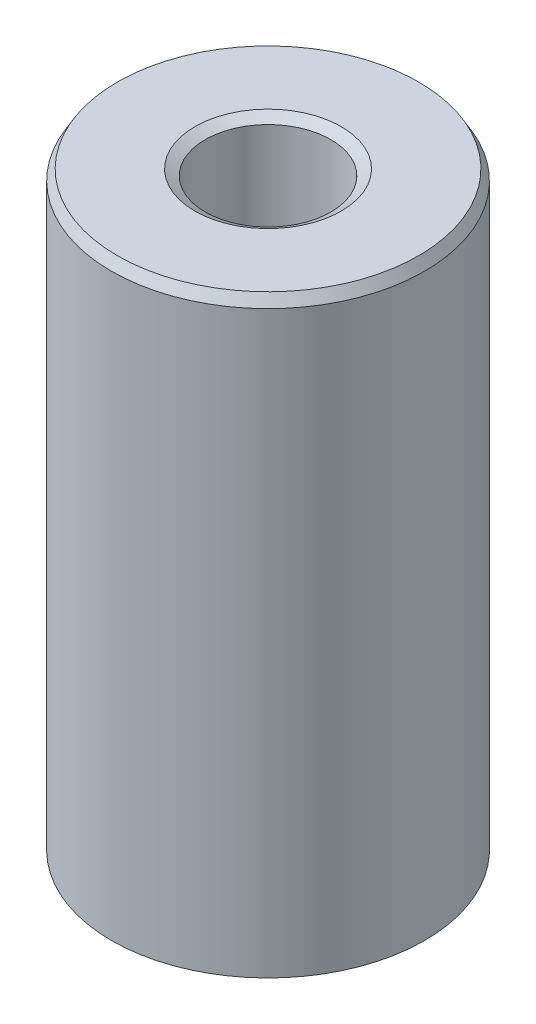
from build123d import *
from OCP.BRepFilletAPI import BRepFilletAPI_MakeChamfer

# Parameters (mm, degrees)
SKETCH1_R           = 7.5
BOSS_EXTRUDE1_DEPTH = 28.553667174
SKETCH2_R           = 3.008081758
CUT_EXTRUDE1_DEPTH  = 31.460005074
CHAMFER1_SIZE       = 0.498138445
CHAMFER1_SIZE2      = 0.287600365


with BuildPart() as part:
    # Sketch1 → Boss-Extrude1 (new body)
    with BuildSketch(Plane(origin=(0, 0, 0), x_dir=(1, 0, 0), z_dir=(0, 1, 0))):
        Circle(SKETCH1_R)
    extrude(amount=BOSS_EXTRUDE1_DEPTH)

    # Sketch2 → Cut-Extrude1 (cut, through all)
    with BuildSketch(Plane(origin=(0, 0, 0), x_dir=(1, 0, 0), z_dir=(0, 1, 0))):
        Circle(SKETCH2_R)
    extrude(amount=CUT_EXTRUDE1_DEPTH, mode=Mode.SUBTRACT)

    # Chamfer1: one chamfer whose edges measure the first distance from different faces: ONE call of the kernel's chamfer builder (chamfer() names one face for all edges)
    chamfer1_edges_1 = [part.edges().sort_by_distance(p)[0] for p in [
        (-3.008081758, 28.553667174, 0),
    ]]
    chamfer1_side_1 = [part.faces().sort_by_distance(p)[0] for p in [
        (-7.287867966, 28.553667174, 0),
    ]]
    chamfer1_edges_2 = [part.edges().sort_by_distance(p)[0] for p in [
        (-3.008081758, 0, 0),
    ]]
    chamfer1_side_2 = [part.faces().sort_by_distance(p)[0] for p in [
        (-3.008081758, 14.276833587, 0),
    ]]
    chamfer1_edges_3 = [part.edges().sort_by_distance(p)[0] for p in [
        (-7.5, 0, 0),
    ]]
    chamfer1_side_3 = [part.faces().sort_by_distance(p)[0] for p in [
        (-7.287867966, 0, 0),
    ]]
    chamfer1_edges_4 = [part.edges().sort_by_distance(p)[0] for p in [
        (-7.5, 28.553667174, 0),
    ]]
    chamfer1_side_4 = [part.faces().sort_by_distance(p)[0] for p in [
        (-7.5, 14.276833587, 0),
    ]]
    chamfer1 = BRepFilletAPI_MakeChamfer(part.part.solid().wrapped)
    for e in chamfer1_edges_1:
        chamfer1.Add(CHAMFER1_SIZE, CHAMFER1_SIZE2, e.wrapped, chamfer1_side_1[0].wrapped)  # the first distance lies on this face
    for e in chamfer1_edges_2:
        chamfer1.Add(CHAMFER1_SIZE, CHAMFER1_SIZE2, e.wrapped, chamfer1_side_2[0].wrapped)  # the first distance lies on this face
    for e in chamfer1_edges_3:
        chamfer1.Add(CHAMFER1_SIZE, CHAMFER1_SIZE2, e.wrapped, chamfer1_side_3[0].wrapped)  # the first distance lies on this face
    for e in chamfer1_edges_4:
        chamfer1.Add(CHAMFER1_SIZE, CHAMFER1_SIZE2, e.wrapped, chamfer1_side_4[0].wrapped)  # the first distance lies on this face
    add(Compound.cast(chamfer1.Shape()), mode=Mode.REPLACE)


solid = part.part
